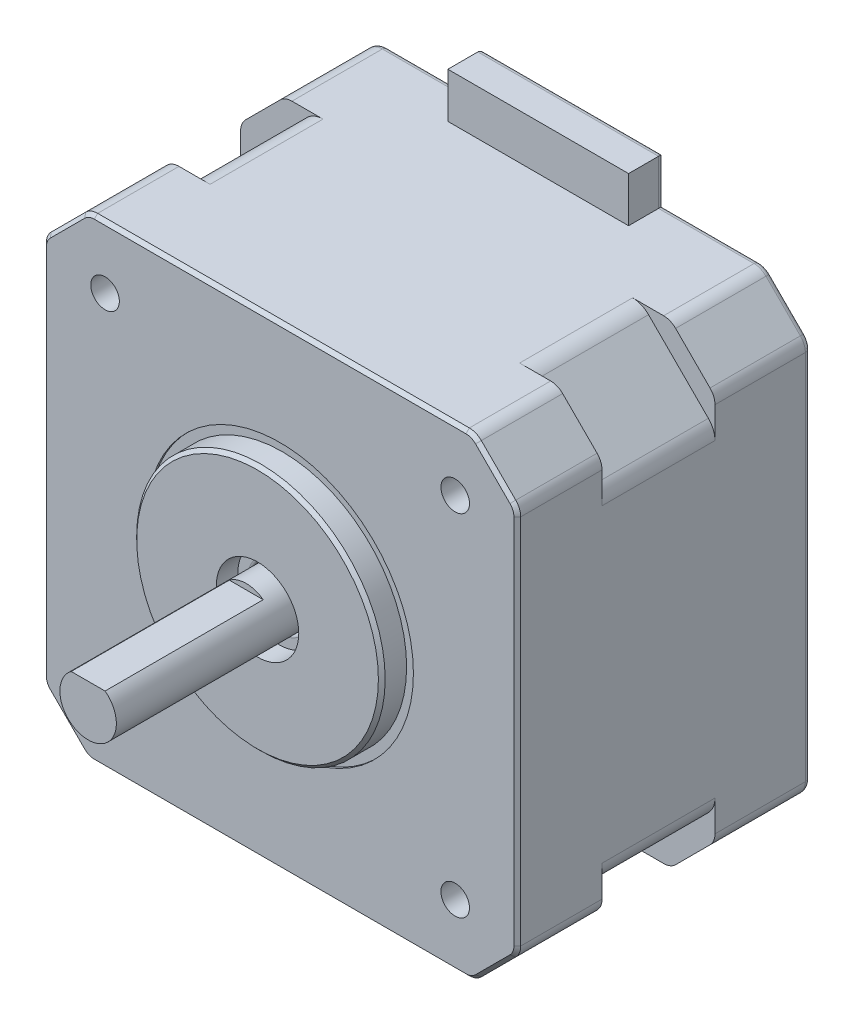
from build123d import *

# Parameters (mm, degrees)
SKETCH_1_W               = 42
SKETCH_1_H               = 42
EXTRUDE_1_DEPTH          = 26
SKETCH_2_W               = 16
SKETCH_2_H               = 4
EXTRUDE_2_DEPTH          = 3.15
CUT_EXTRUDE_1_REACH      = 43.737
CUT_EXTRUDE_START        = -8.5
CUT_EXTRUDE_2_DEPTH      = 10
FILLET_2_R               = 1.5
FILLET_3_R               = 2
SKETCH_10_R              = 11.8
CUT_EXTRUDE_5_DEPTH      = 0.2
SKETCH_11_R              = 11
SKETCH_11_R_2            = 3.65
EXTRUDE_7_DEPTH          = 2.2
SKETCH_12_R              = 3.65
SKETCH_12_R_2            = 2.5
EXTRUDE_8_DEPTH          = 0.3
FILLET_4_R               = 0.3
SKETCH_13_R              = 2.5
EXTRUDE_9_DEPTH          = 17.2
CUT_EXTRUDE_6_DEPTH      = 54.990739947
CUT_EXTRUDE_6_DEPTH_BACK = 14
SKETCH_15_R              = 1.2645
CUT_EXTRUDE_7_DEPTH      = 4.4
CHAMFER_4_SIZE           = 0.3
CHAMFER_5_SIZE           = 0.3
FILLET_5_R               = 0.5


with BuildPart() as part:
    # 草图1 → 凸台-拉伸1 (new body)
    with BuildSketch(Plane.XY):
        Rectangle(SKETCH_1_W, SKETCH_1_H)
    extrude(amount=EXTRUDE_1_DEPTH)

    # 草图2 → 凸台-拉伸2 (add)
    with BuildSketch(Plane(origin=(0, 0, 0), x_dir=(-1, 0, 0), z_dir=(0, 0, -1))):
        with Locations((0, 23)):
            Rectangle(SKETCH_2_W, SKETCH_2_H)
    extrude(amount=-EXTRUDE_2_DEPTH)

    # 草图3 → 切除-拉伸1 (cut, up to next)
    with BuildSketch(Plane(origin=(0, 0, 0), x_dir=(-1, 0, 0), z_dir=(0, 0, -1)), mode=Mode.PRIVATE) as cut_extrude_1_sk1:
        Polygon((-17.075, 21), (-21, 17.075), (-21, 21), align=None)
    cut_extrude_1_tool1 = extrude(cut_extrude_1_sk1.sketch, amount=-CUT_EXTRUDE_1_REACH, mode=Mode.PRIVATE) & part.part
    # 草图3 → 切除-拉伸1 (cut, up to next)
    with BuildSketch(Plane(origin=(0, 0, 0), x_dir=(-1, 0, 0), z_dir=(0, 0, -1)), mode=Mode.PRIVATE) as cut_extrude_1_sk2:
        Polygon((17.075, 21), (21, 17.075), (21, 21), align=None)
    cut_extrude_1_tool2 = extrude(cut_extrude_1_sk2.sketch, amount=-CUT_EXTRUDE_1_REACH, mode=Mode.PRIVATE) & part.part
    # 草图3 → 切除-拉伸1 (cut, up to next)
    with BuildSketch(Plane(origin=(0, 0, 0), x_dir=(-1, 0, 0), z_dir=(0, 0, -1)), mode=Mode.PRIVATE) as cut_extrude_1_sk3:
        Polygon((21, -17.075), (17.075, -21), (21, -21), align=None)
    cut_extrude_1_tool3 = extrude(cut_extrude_1_sk3.sketch, amount=-CUT_EXTRUDE_1_REACH, mode=Mode.PRIVATE) & part.part
    # 草图3 → 切除-拉伸1 (cut, up to next)
    with BuildSketch(Plane(origin=(0, 0, 0), x_dir=(-1, 0, 0), z_dir=(0, 0, -1)), mode=Mode.PRIVATE) as cut_extrude_1_sk4:
        Polygon((-21, -17.075), (-17.075, -21), (-21, -21), align=None)
    cut_extrude_1_tool4 = extrude(cut_extrude_1_sk4.sketch, amount=-CUT_EXTRUDE_1_REACH, mode=Mode.PRIVATE) & part.part
    add(cut_extrude_1_tool1.solids().sort_by_distance((19.691667, 19.691667, 0))[0], mode=Mode.SUBTRACT)
    add(cut_extrude_1_tool2.solids().sort_by_distance((-19.691667, 19.691667, 0))[0], mode=Mode.SUBTRACT)
    add(cut_extrude_1_tool3.solids().sort_by_distance((-19.691667, -19.691667, 0))[0], mode=Mode.SUBTRACT)
    add(cut_extrude_1_tool4.solids().sort_by_distance((19.691667, -19.691667, 0))[0], mode=Mode.SUBTRACT)

    # 草图4 → 切除-拉伸2 (cut)
    with BuildSketch(Plane(origin=(0, 0, 0), x_dir=(-1, 0, 0), z_dir=(0, 0, -1)).offset(CUT_EXTRUDE_START)):
        Polygon((-21, 14.532), (-14.532, 21), (-21, 21), align=None)
        Polygon((14.532, 21), (21, 14.532), (21, 21), align=None)
        Polygon((21, -14.532), (14.532, -21), (21, -21), align=None)
        Polygon((-14.532, -21), (-21, -14.532), (-21, -21), align=None)
    extrude(amount=-CUT_EXTRUDE_2_DEPTH, mode=Mode.SUBTRACT)

    # 圆角2
    fillet_2_edges = [part.edges().sort_by_distance(p)[0] for p in [
        (21, -17.075, 22.25),
        (17.075, -21, 22.25),
        (-21, -17.075, 22.25),
        (-17.075, -21, 22.25),
        (-17.075, 21, 22.25),
        (-21, 17.075, 22.25),
        (17.075, 21, 22.25),
        (21, 17.075, 22.25),
        (17.075, -21, 4.25),
        (21, -17.075, 4.25),
        (-21, -17.075, 4.25),
        (-17.075, -21, 4.25),
        (-17.075, 21, 4.25),
        (-21, 17.075, 4.25),
        (21, 17.075, 4.25),
        (17.075, 21, 4.25),
    ]]
    fillet(fillet_2_edges, radius=FILLET_2_R)

    # 圆角3
    fillet_3_edges = [part.edges().sort_by_distance(p)[0] for p in [
        (-21, -14.532, 13.5),
        (-14.532, -21, 13.5),
        (-14.532, 21, 13.5),
        (-21, 14.532, 13.5),
        (21, 14.532, 13.5),
        (14.532, 21, 13.5),
        (14.532, -21, 13.5),
        (21, -14.532, 13.5),
    ]]
    fillet(fillet_3_edges, radius=FILLET_3_R)

    # 草图10 → 切除-拉伸5 (cut)
    with BuildSketch(Plane.XY.offset(26)):
        Circle(SKETCH_10_R)
    extrude(amount=-CUT_EXTRUDE_5_DEPTH, mode=Mode.SUBTRACT)

    # 草图11 → 凸台-拉伸7 (add)
    with BuildSketch(Plane.XY.offset(25.8)):
        Circle(SKETCH_11_R)
        Circle(SKETCH_11_R_2, mode=Mode.SUBTRACT)
    extrude(amount=EXTRUDE_7_DEPTH)

    # 草图12 → 凸台-拉伸8 (add)
    with BuildSketch(Plane.XY.offset(25.8)):
        Circle(SKETCH_12_R)
        Circle(SKETCH_12_R_2, mode=Mode.SUBTRACT)
    extrude(amount=EXTRUDE_8_DEPTH)

    # 圆角4
    fillet_4_edges = [part.edges().sort_by_distance(p)[0] for p in [
        (-2.5, 0, 26.1),
    ]]
    fillet(fillet_4_edges, radius=FILLET_4_R - 0.0001)  # a hair under: the kernel refuses the full size

    # 草图13 → 凸台-拉伸9 (add)
    with BuildSketch(Plane.XY.offset(25.8)):
        with Locations(Location((0, 0, 0), (0, 0, 180))):
            Circle(SKETCH_13_R)
    extrude(amount=EXTRUDE_9_DEPTH)

    # 草图14 → 切除-拉伸6 (cut, two sides: drawn at the far end of the back side and taken through both)
    with BuildSketch(Plane.XY.offset(43).offset(-CUT_EXTRUDE_6_DEPTH_BACK)):
        Polygon((-75.850602173, 2), (-1.5, 2), (1.5, 2), (75.850602173, 2), (75.850602173, 150.701204346), (-75.850602173, 150.701204346), align=None)
    extrude(amount=CUT_EXTRUDE_6_DEPTH + CUT_EXTRUDE_6_DEPTH_BACK, mode=Mode.SUBTRACT)

    # 草图15 → 切除-拉伸7 (cut)
    with BuildSketch(Plane.XY.offset(26)):
        with Locations((-15.5, 15.5)):
            Circle(SKETCH_15_R)
        with Locations((15.5, 15.5)):
            Circle(SKETCH_15_R)
        with Locations((15.5, -15.5)):
            Circle(SKETCH_15_R)
        with Locations((-15.5, -15.5)):
            Circle(SKETCH_15_R)
    extrude(amount=-CUT_EXTRUDE_7_DEPTH, mode=Mode.SUBTRACT)

    # 倒角4
    chamfer_4_edges = [part.edges().sort_by_distance(p)[0] for p in [
        (-11, 0, 28),
    ]]
    chamfer(chamfer_4_edges, length=CHAMFER_4_SIZE)

    # 倒角5
    chamfer_5_edges = [part.edges().sort_by_distance(p)[0] for p in [
        (-19.0375, -19.0375, 26),
        (-21, 0, 26),
        (19.0375, -19.0375, 26),
        (21, 0, 26),
        (19.0375, 19.0375, 26),
        (0, 21, 26),
        (-19.0375, 19.0375, 26),
        (0, -21, 26),
        (17.027704805, 20.885819299, 26),
        (20.885819299, 17.027704805, 26),
        (20.885819299, -17.027704805, 26),
        (17.027704805, -20.885819299, 26),
        (-17.027704805, 20.885819299, 26),
        (-20.885819299, 17.027704805, 26),
        (-17.027704805, -20.885819299, 26),
        (-20.885819299, -17.027704805, 26),
    ]]
    chamfer(chamfer_5_edges, length=CHAMFER_5_SIZE)

    # 圆角5
    fillet_5_edges = [part.edges().sort_by_distance(p)[0] for p in [
        (-21, 0, 0),
        (-12.226839828, 21, 0),
        (0, -21, 0),
        (21, 0, 0),
        (19.0375, -19.0375, 0),
        (-19.0375, -19.0375, 0),
        (-19.0375, 19.0375, 0),
        (12.226839828, 21, 0),
        (19.0375, 19.0375, 0),
        (17.027704805, 20.885819299, 0),
        (20.885819299, 17.027704805, 0),
        (20.885819299, -17.027704805, 0),
        (17.027704805, -20.885819299, 0),
        (-20.885819299, 17.027704805, 0),
        (-17.027704805, 20.885819299, 0),
        (-20.885819299, -17.027704805, 0),
        (-17.027704805, -20.885819299, 0),
        (-8, 23, 0),
        (0, 25, 0),
        (8, 23, 0),
    ]]
    fillet(fillet_5_edges, radius=FILLET_5_R)


solid = part.part
